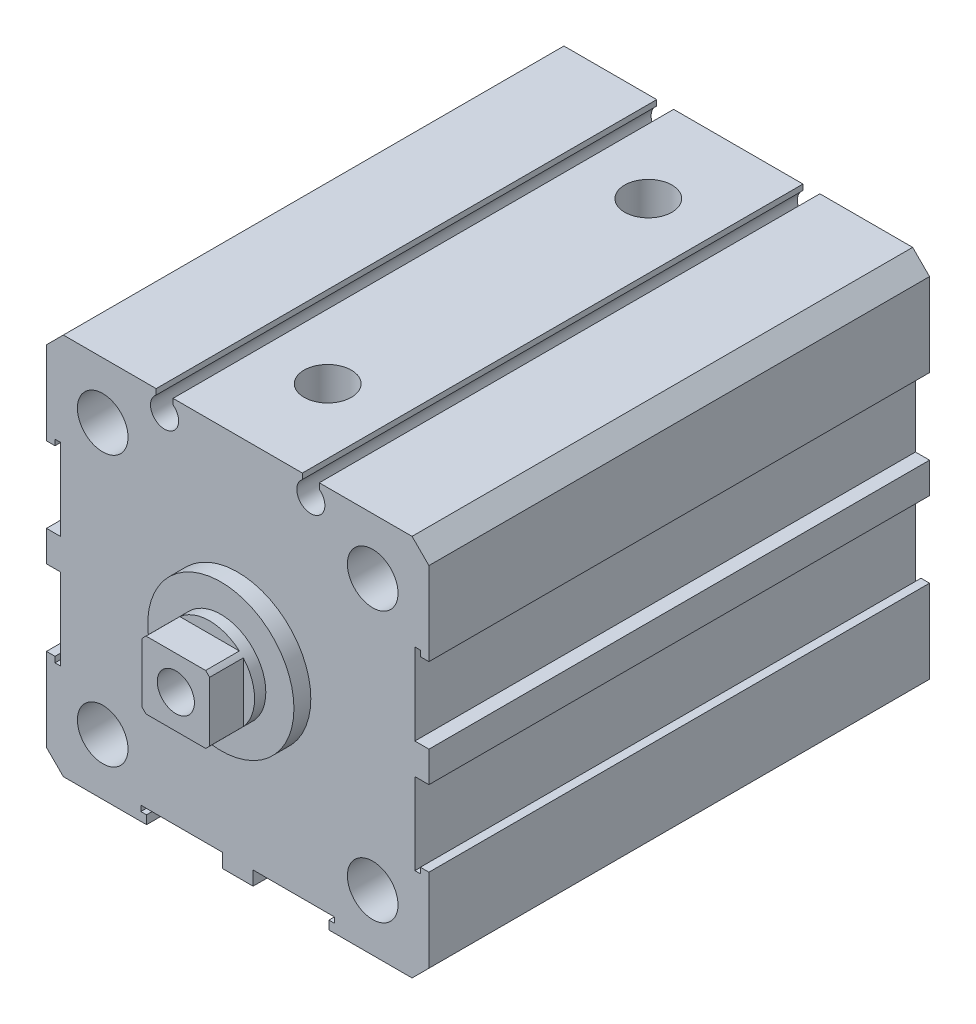
from build123d import *

# Parameters (mm, degrees)
SKETCH_1_W                     = 34
SKETCH_1_H                     = 34
EXTRUDE_1_DEPTH                = 44.5
SKETCH_2_R                     = 10
CUT_EXTRUDE_1_DEPTH            = 0.5
CUT_EXTRUDE_START              = -0.5
SKETCH_3_R                     = 10
CUT_EXTRUDE_2_DEPTH            = 0.5
SKETCH_4_R                     = 4
EXTRUDE_2_DEPTH                = 6
CHAMFER_1_SIZE                 = 1.5
HOLE_WIZARD_M4_1_D             = 4.5
HOLE_WIZARD_M4_1_CBORE_D       = 8
HOLE_WIZARD_M4_1_CBORE_DEPTH   = 4
HOLE_WIZARD_M4_1_2_D           = 3.3
HOLE_WIZARD_M4_1_2_DEPTH       = 10.1
HOLE_WIZARD_M4_1_2_TIP         = 0.991420021
SKETCH_9_W                     = 5.05425195
SKETCH_9_H                     = 13.3836291
SKETCH_9_W_2                   = 3.579653673
SKETCH_9_H_2                   = 11.317985889
CUT_EXTRUDE_3_DEPTH            = 3
SKETCH_14_R                    = 1.25
CUT_EXTRUDE_6_DEPTH            = 51.5791459
SKETCH_15_W                    = 1.5
SKETCH_15_H                    = 1
CUT_EXTRUDE_7_DEPTH            = 51.5791459
PATTERN_CIRCULAR_1_COUNT       = 2
PATTERN_CIRCULAR_1_ANGLE       = 90
SKETCH_16_R                    = 6.5
SKETCH_16_R_2                  = 1.65
EXTRUDE_3_DEPTH                = 2
EXTRUDE_START                  = 0.5
SKETCH_17_R                    = 10
SKETCH_17_R_2                  = 1.65
EXTRUDE_4_DEPTH                = 0.5
SKETCH_18_W                    = 1.251760675
SKETCH_18_H                    = 6.736418335
CUT_EXTRUDE_8_DEPTH            = 51.5791459
SKETCH_19_W                    = 0.490453646
SKETCH_19_H                    = 0.506695446
CUT_EXTRUDE_9_DEPTH            = 51.5791459
PATTERN_START                  = -17
PATTERN_CIRCULAR_2_OUTLINE_W   = 6.736418335
PATTERN_CIRCULAR_2_OUTLINE_H   = 44.5
PATTERN_CIRCULAR_2_DEPTH       = 1.251760675
PATTERN_START_2                = -8.103506379
PATTERN_CIRCULAR_2_2_OUTLINE_W = 1.251760675
PATTERN_CIRCULAR_2_2_OUTLINE_H = 44.5
PATTERN_CIRCULAR_2_2_DEPTH     = 6.736418335
PATTERN_START_3                = 1.367088044
PATTERN_CIRCULAR_2_3_OUTLINE_W = 1.251760675
PATTERN_CIRCULAR_2_3_OUTLINE_H = 44.5
PATTERN_CIRCULAR_2_3_DEPTH     = 6.736418335
PATTERN_START_4                = -16.238692971
PATTERN_CIRCULAR_2_4_OUTLINE_W = 0.506695446
PATTERN_CIRCULAR_2_4_OUTLINE_H = 44.5
PATTERN_CIRCULAR_2_4_DEPTH     = 0.490453646
PATTERN_START_5                = -8.610201825
PATTERN_CIRCULAR_2_5_OUTLINE_W = 0.490453646
PATTERN_CIRCULAR_2_5_OUTLINE_H = 44.5
PATTERN_CIRCULAR_2_5_DEPTH     = 0.506695446
PATTERN_START_6                = 8.103506379
PATTERN_CIRCULAR_2_6_OUTLINE_W = 0.490453646
PATTERN_CIRCULAR_2_6_OUTLINE_H = 44.5
PATTERN_CIRCULAR_2_6_DEPTH     = 0.506695446
HOLE_WIZARD_M5_1_D             = 4.2
HOLE_WIZARD_M5_1_DEPTH         = 12.4
HOLE_WIZARD_M5_1_TIP           = 1.2618073


# Read off the part's stored shape, not the designer's step: 阵列(圆周)2
with BuildPart() as part:
    # 草图1 → 凸台-拉伸1 (new body)
    with BuildSketch(Plane.XY):
        Rectangle(SKETCH_1_W, SKETCH_1_H)
    extrude(amount=EXTRUDE_1_DEPTH)

    # 草图2 → 切除-拉伸1 (cut)
    with BuildSketch(Plane.XY.offset(44.5)):
        Circle(SKETCH_2_R)
    extrude(amount=-CUT_EXTRUDE_1_DEPTH, mode=Mode.SUBTRACT)

    # 草图3 → 切除-拉伸2 (cut)
    with BuildSketch(Plane(origin=(0, 0, 0), x_dir=(-1, 0, 0), z_dir=(0, 0, -1)).offset(CUT_EXTRUDE_START)):
        with Locations(Location((0, 0, 0), (0, 0, 180))):
            Circle(SKETCH_3_R)
    extrude(amount=CUT_EXTRUDE_2_DEPTH, mode=Mode.SUBTRACT)

    # 草图4 → 凸台-拉伸2 (add)
    with BuildSketch(Plane.XY.offset(44)):
        Circle(SKETCH_4_R)
    extrude(amount=EXTRUDE_2_DEPTH)

    # 倒角1
    chamfer_1_edges = [part.edges().sort_by_distance(p)[0] for p in [
        (-17, 17, 22.25),
        (17, 17, 22.25),
        (17, -17, 22.25),
        (-17, -17, 22.25),
    ]]
    chamfer(chamfer_1_edges, length=CHAMFER_1_SIZE)

    # Hole Wizard M4 _1 (through all)
    with Locations(Plane(origin=(0, 0, 0), x_dir=(-1, 0, 0), z_dir=(0, 0, -1))):
        with Locations((-12, 12), (12, -12), (12, 12), (-12, -12)):
            CounterBoreHole(HOLE_WIZARD_M4_1_D / 2, HOLE_WIZARD_M4_1_CBORE_D / 2, HOLE_WIZARD_M4_1_CBORE_DEPTH)

    # Hole Wizard M4 _1 2
    with Locations(Plane.XY.offset(50)):
        with Locations((0, 0)):
            Hole(HOLE_WIZARD_M4_1_2_D / 2, depth=HOLE_WIZARD_M4_1_2_DEPTH)
            with Locations((0, 0, -(HOLE_WIZARD_M4_1_2_DEPTH + HOLE_WIZARD_M4_1_2_TIP / 2))):  # 118° drill point
                Cone(0, HOLE_WIZARD_M4_1_2_D / 2, HOLE_WIZARD_M4_1_2_TIP, mode=Mode.SUBTRACT)

    # 草图9 → 切除-拉伸3 (cut)
    with BuildSketch(Plane.XY.offset(50)):
        with Locations((-5.527125975, -0.54919334)):
            Rectangle(SKETCH_9_W, SKETCH_9_H)
        with Locations((4.789826836, -0.152935728)):
            Rectangle(SKETCH_9_W_2, SKETCH_9_H_2)
    cut_extrude_3 = extrude(amount=-CUT_EXTRUDE_3_DEPTH, mode=Mode.SUBTRACT)

    # 草图14 → 切除-拉伸6 (cut, through all)
    with BuildSketch(Plane.XY.offset(44.5)):
        with Locations((-6.5, 15.5)):
            Circle(SKETCH_14_R)
        with Locations(Location((6.5, 15.5, 0), (0, 0, 180))):
            Circle(SKETCH_14_R)
    extrude(amount=-CUT_EXTRUDE_6_DEPTH, mode=Mode.SUBTRACT)

    # 草图15 → 切除-拉伸7 (cut, through all)
    with BuildSketch(Plane.XY.offset(44.5)):
        with Locations((-6.5, 16.5)):
            Rectangle(SKETCH_15_W, SKETCH_15_H)
        with Locations((6.5, 16.5)):
            Rectangle(SKETCH_15_W, SKETCH_15_H)
    extrude(amount=-CUT_EXTRUDE_7_DEPTH, mode=Mode.SUBTRACT)

    # 阵列(圆周)1: 切除-拉伸3 ×2 about axis
    pattern_circular_1_axis = Axis((0, 0, 50), (0, 0, -1))
    for i in range(1, PATTERN_CIRCULAR_1_COUNT):
        add(cut_extrude_3.rotate(pattern_circular_1_axis, i * PATTERN_CIRCULAR_1_ANGLE / (PATTERN_CIRCULAR_1_COUNT - 1)), mode=Mode.SUBTRACT)

    # 草图16 → 凸台-拉伸3 (add)
    with BuildSketch(Plane.XY.offset(44)):
        Circle(SKETCH_16_R)
        Circle(SKETCH_16_R_2, mode=Mode.SUBTRACT)
    extrude(amount=EXTRUDE_3_DEPTH)

    # 草图17 → 凸台-拉伸4 (add)
    with BuildSketch(Plane.XY.offset(44).offset(EXTRUDE_START)):
        with Locations(Location((0, 0, 0), (0, 0, 180))):
            Circle(SKETCH_17_R)
        Circle(SKETCH_17_R_2, mode=Mode.SUBTRACT)
    extrude(amount=-EXTRUDE_4_DEPTH)

    # 草图18 → 切除-拉伸8 (cut, through all)
    with BuildSketch(Plane.XY.offset(44.5)):
        with Locations((16.374119663, 4.735297212)):
            Rectangle(SKETCH_18_W, SKETCH_18_H)
        with Locations((16.374119663, -4.735297212)):
            Rectangle(SKETCH_18_W, SKETCH_18_H)
    extrude(amount=-CUT_EXTRUDE_8_DEPTH, mode=Mode.SUBTRACT)

    # 草图19 → 切除-拉伸9 (cut, through all)
    with BuildSketch(Plane.XY.offset(44.5)):
        with Locations((15.993466148, 8.356854102)):
            Rectangle(SKETCH_19_W, SKETCH_19_H)
        with Locations((15.993466148, -8.356854102)):
            Rectangle(SKETCH_19_W, SKETCH_19_H)
    extrude(amount=-CUT_EXTRUDE_9_DEPTH, mode=Mode.SUBTRACT)

    # 阵列(圆周)2 outline → 阵列(圆周)2 (cut)
    with BuildSketch(Plane(origin=(0, 0, 0), x_dir=(1, 0, 0), z_dir=(0, 1, 0)).offset(PATTERN_START)):
        with Locations((4.735297212, -22.25)):
            Rectangle(PATTERN_CIRCULAR_2_OUTLINE_W, PATTERN_CIRCULAR_2_OUTLINE_H)
        with Locations((-4.735297212, -22.25)):
            Rectangle(PATTERN_CIRCULAR_2_OUTLINE_W, PATTERN_CIRCULAR_2_OUTLINE_H)
    extrude(amount=PATTERN_CIRCULAR_2_DEPTH, mode=Mode.SUBTRACT)

    # Pattern Circular 2 2 outline → Pattern Circular 2 2 (cut)
    with BuildSketch(Plane(origin=(0, 0, 0), x_dir=(1, 0, 0), z_dir=(0, 1, 0)).offset(PATTERN_START_2)):
        with Locations((-16.374119663, -22.25)):
            Rectangle(PATTERN_CIRCULAR_2_2_OUTLINE_W, PATTERN_CIRCULAR_2_2_OUTLINE_H)
    extrude(amount=PATTERN_CIRCULAR_2_2_DEPTH, mode=Mode.SUBTRACT)

    # Pattern Circular 2 3 outline → Pattern Circular 2 3 (cut)
    with BuildSketch(Plane(origin=(0, 0, 0), x_dir=(1, 0, 0), z_dir=(0, 1, 0)).offset(PATTERN_START_3)):
        with Locations((-16.374119663, -22.25)):
            Rectangle(PATTERN_CIRCULAR_2_3_OUTLINE_W, PATTERN_CIRCULAR_2_3_OUTLINE_H)
    extrude(amount=PATTERN_CIRCULAR_2_3_DEPTH, mode=Mode.SUBTRACT)

    # Pattern Circular 2 4 outline → Pattern Circular 2 4 (cut)
    with BuildSketch(Plane(origin=(0, 0, 0), x_dir=(1, 0, 0), z_dir=(0, 1, 0)).offset(PATTERN_START_4)):
        with Locations((8.356854102, -22.25)):
            Rectangle(PATTERN_CIRCULAR_2_4_OUTLINE_W, PATTERN_CIRCULAR_2_4_OUTLINE_H)
        with Locations((-8.356854102, -22.25)):
            Rectangle(PATTERN_CIRCULAR_2_4_OUTLINE_W, PATTERN_CIRCULAR_2_4_OUTLINE_H)
    extrude(amount=PATTERN_CIRCULAR_2_4_DEPTH, mode=Mode.SUBTRACT)

    # Pattern Circular 2 5 outline → Pattern Circular 2 5 (cut)
    with BuildSketch(Plane(origin=(0, 0, 0), x_dir=(1, 0, 0), z_dir=(0, 1, 0)).offset(PATTERN_START_5)):
        with Locations((-15.993466148, -22.25)):
            Rectangle(PATTERN_CIRCULAR_2_5_OUTLINE_W, PATTERN_CIRCULAR_2_5_OUTLINE_H)
    extrude(amount=PATTERN_CIRCULAR_2_5_DEPTH, mode=Mode.SUBTRACT)

    # Pattern Circular 2 6 outline → Pattern Circular 2 6 (cut)
    with BuildSketch(Plane(origin=(0, 0, 0), x_dir=(1, 0, 0), z_dir=(0, 1, 0)).offset(PATTERN_START_6)):
        with Locations((-15.993466148, -22.25)):
            Rectangle(PATTERN_CIRCULAR_2_6_OUTLINE_W, PATTERN_CIRCULAR_2_6_OUTLINE_H)
    extrude(amount=PATTERN_CIRCULAR_2_6_DEPTH, mode=Mode.SUBTRACT)

    # M5 螺纹孔1
    with Locations(Plane(origin=(0, 17, 0), x_dir=(-1, 0, 0), z_dir=(0, 1, 0))):
        with Locations((0, 36.5), (0, 8)):
            Hole(HOLE_WIZARD_M5_1_D / 2, depth=HOLE_WIZARD_M5_1_DEPTH)
            with Locations((0, 0, -(HOLE_WIZARD_M5_1_DEPTH + HOLE_WIZARD_M5_1_TIP / 2))):  # 118° drill point
                Cone(0, HOLE_WIZARD_M5_1_D / 2, HOLE_WIZARD_M5_1_TIP, mode=Mode.SUBTRACT)


solid = part.part
